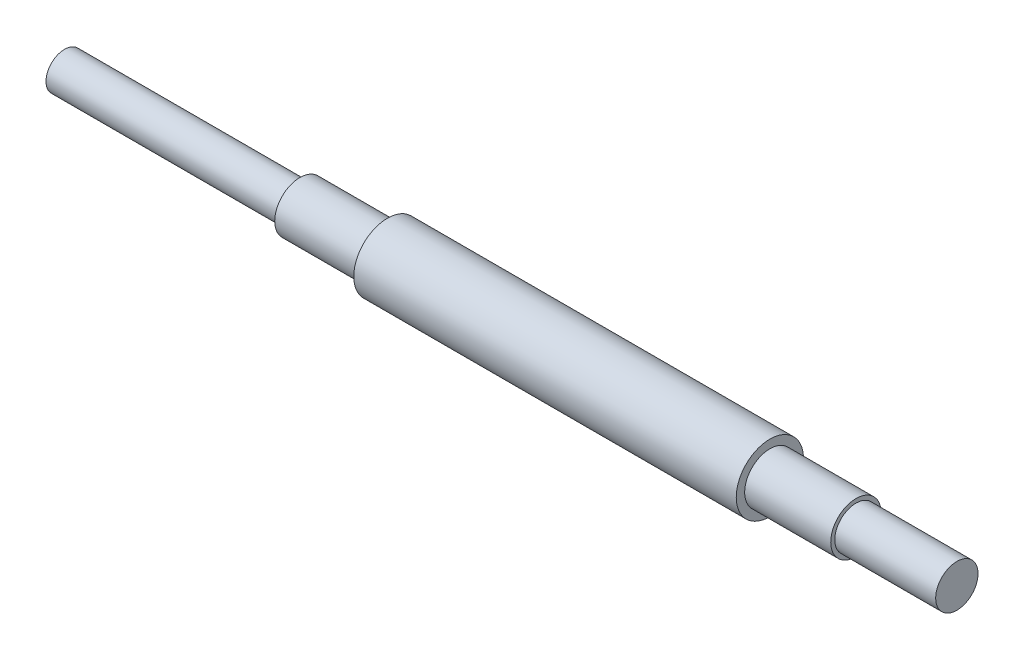
from build123d import *


with BuildPart() as part:
    # Sketch1 → Revolve1 (revolve)
    with BuildSketch(Plane(origin=(0, 0, 0), x_dir=(1, 0, 0), z_dir=(0, 1, 0))):
        Polygon((-78.63058905, 0), (-78.63058905, 3.499993), (-34.18058905, 3.499993), (-34.18058905, 4.7625), (-17.67058905, 4.7625), (-17.67058905, 6.35), (54.54937095, 6.35), (54.54937095, 4.7625), (70.80537095, 4.7625), (70.80537095, 3.99923), (89.85537095, 3.99923), (89.85537095, 0), align=None)
    revolve(axis=Axis((-97.950567047, 0, 0), (1, 0, 0)))


solid = part.part
